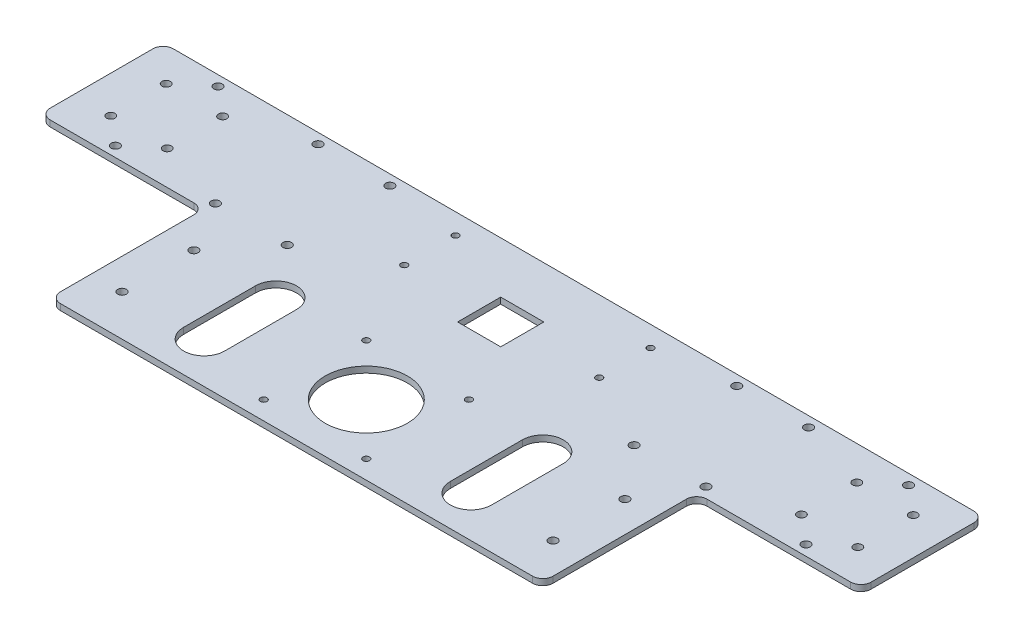
from build123d import *

# Parameters (mm, degrees)
SKETCH_1_R          = 1.6
SKETCH_1_W          = 21
SKETCH_1_H          = 21
SKETCH_1_R_2        = 20
EXTRUDE_1456_DEPTH  = 3
SKETCH_2_R          = 2.05
SKETCH_2_R_2        = 2.1
CUT_EXTRUDE_1_DEPTH = 250.229009796
FILLET_1_R          = 5
SKETCH1_R           = 2.1
CUT_EXTRUDE4_DEPTH  = 250.229009796


with BuildPart() as part:
    # 草图1 → Extrude 1456 (new body)
    with BuildSketch(Plane(origin=(0, 0, 0), x_dir=(1, 0, 0), z_dir=(0, 1, 0))):
        Polygon((-167.174075228, 46.128249268), (-167.174075228, -13.871750732), (-87.174075228, -13.871750732), (-87.174075228, -88.871750732), (152.825924772, -88.871750732), (152.825924772, -13.871750732), (232.825924772, -13.871750732), (232.825924772, 46.128249268), align=None)
        with Locations((-14.674075228, 11.128249268)):
            Circle(SKETCH_1_R, mode=Mode.SUBTRACT)
        with Locations((-14.674075228, 36.128249268)):
            Circle(SKETCH_1_R, mode=Mode.SUBTRACT)
        with Locations((32.825924772, 10.628249268)):
            Rectangle(SKETCH_1_W, SKETCH_1_H, mode=Mode.SUBTRACT)
        with Locations((80.325924772, 11.128249268)):
            Circle(SKETCH_1_R, mode=Mode.SUBTRACT)
        with Locations((80.325924772, 36.128249268)):
            Circle(SKETCH_1_R, mode=Mode.SUBTRACT)
        with Locations((57.825924772, -29.871750732)):
            Circle(SKETCH_1_R, mode=Mode.SUBTRACT)
        with Locations((7.825924772, -79.871750732)):
            Circle(SKETCH_1_R, mode=Mode.SUBTRACT)
        with Locations((7.825924772, -29.871750732)):
            Circle(SKETCH_1_R, mode=Mode.SUBTRACT)
        with Locations((57.825924772, -79.871750732)):
            Circle(SKETCH_1_R, mode=Mode.SUBTRACT)
        with Locations((32.825924772, -54.871750732)):
            Circle(SKETCH_1_R_2, mode=Mode.SUBTRACT)
    extrude(amount=EXTRUDE_1456_DEPTH)

    # 草图2 → 切除-拉伸1 (cut, through all)
    with BuildSketch(Plane(origin=(0, 3, 0), x_dir=(1, 0, 0), z_dir=(0, 1, 0))):
        with Locations((-149.174075228, 29.628249268)):
            Circle(SKETCH_2_R)
        with Locations((-149.174075228, 2.628249268)):
            Circle(SKETCH_2_R)
        with Locations((-121.674075228, 29.628249268)):
            Circle(SKETCH_2_R)
        with Locations((-121.674075228, 2.628249268)):
            Circle(SKETCH_2_R)
        with Locations((-51.674075228, 41.128249268)):
            Circle(SKETCH_2_R_2)
        with Locations((-86.674075228, 41.128249268)):
            Circle(SKETCH_2_R_2)
        with Locations((-51.674075228, -8.871750732)):
            Circle(SKETCH_2_R_2)
        with Locations((-86.674075228, -8.871750732)):
            Circle(SKETCH_2_R_2)
        with Locations((-135.424075228, 41.128249268)):
            Circle(SKETCH_2_R_2)
        with Locations((-135.424075228, -8.871750732)):
            Circle(SKETCH_2_R_2)
        with Locations((201.075924772, -8.871750732)):
            Circle(SKETCH_2_R_2)
        with Locations((201.075924772, 41.128249268)):
            Circle(SKETCH_2_R_2)
        with Locations((152.325924772, -8.871750732)):
            Circle(SKETCH_2_R_2)
        with Locations((117.325924772, -8.871750732)):
            Circle(SKETCH_2_R_2)
        with Locations((152.325924772, 41.128249268)):
            Circle(SKETCH_2_R_2)
        with Locations((117.325924772, 41.128249268)):
            Circle(SKETCH_2_R_2)
        with Locations((187.325924772, 2.628249268)):
            Circle(SKETCH_2_R)
        with Locations((187.325924772, 29.628249268)):
            Circle(SKETCH_2_R)
        with Locations((214.825924772, 2.628249268)):
            Circle(SKETCH_2_R)
        with Locations((214.825924772, 29.628249268)):
            Circle(SKETCH_2_R)
    extrude(amount=-CUT_EXTRUDE_1_DEPTH, mode=Mode.SUBTRACT)

    # 圆角1
    fillet_1_edges = [part.edges().sort_by_distance(p)[0] for p in [
        (-87.174075228, 1.5, 13.871750732),
        (152.825924772, 1.5, 13.871750732),
        (-167.174075228, 1.5, 13.871750732),
        (-167.174075228, 1.5, -46.128249268),
        (232.825924772, 1.5, -46.128249268),
        (232.825924772, 1.5, 13.871750732),
        (152.825924772, 1.5, 88.871750732),
        (-87.174075228, 1.5, 88.871750732),
    ]]
    fillet(fillet_1_edges, radius=FILLET_1_R)

    # Sketch1 → Cut-Extrude4 (cut, through all)
    with BuildSketch(Plane(origin=(0, 0, 0), x_dir=(1, 0, 0), z_dir=(0, 1, 0))):
        with Locations((-72.174075228, -33.871750732)):
            Circle(SKETCH1_R)
        with Locations((-72.174075228, -68.871750732)):
            Circle(SKETCH1_R)
        with Locations((137.825924772, -68.871750732)):
            Circle(SKETCH1_R)
        with Locations((137.825924772, -33.871750732)):
            Circle(SKETCH1_R)
        with BuildLine():
            Line((-42.174075228, -68.871750732), (-42.174075228, -33.871750732))
            ThreePointArc((-42.174075228, -33.871750732), (-32.174075228, -23.871750732), (-22.174075228, -33.871750732))
            Line((-22.174075228, -33.871750732), (-22.174075228, -68.871750732))
            ThreePointArc((-22.174075228, -68.871750732), (-32.174075228, -78.871750732), (-42.174075228, -68.871750732))
        make_face()
        with BuildLine():
            Line((107.825924772, -68.871750732), (107.825924772, -33.871750732))
            ThreePointArc((107.825924772, -33.871750732), (97.825924772, -23.871750732), (87.825924772, -33.871750732))
            Line((87.825924772, -33.871750732), (87.825924772, -68.871750732))
            ThreePointArc((87.825924772, -68.871750732), (97.825924772, -78.871750732), (107.825924772, -68.871750732))
        make_face()
    extrude(amount=CUT_EXTRUDE4_DEPTH, mode=Mode.SUBTRACT)


solid = part.part
